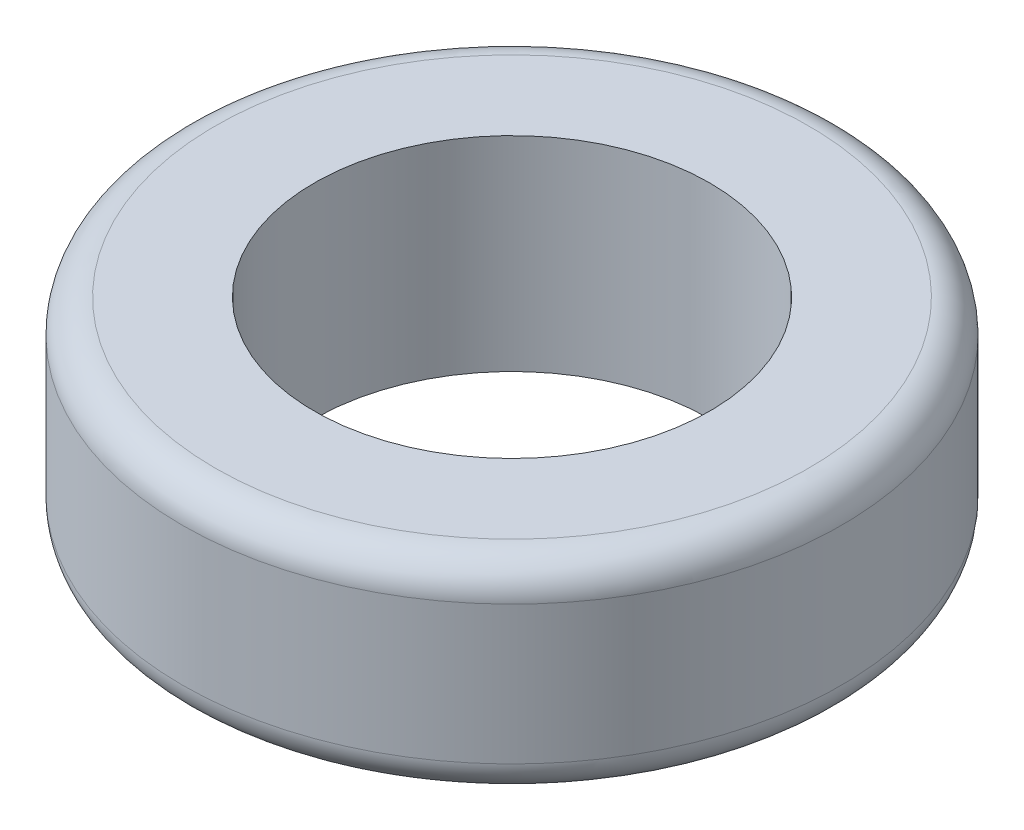
from build123d import *

# Parameters (mm, degrees)
SKETCH1_R           = 10
SKETCH1_R_2         = 6
BOSS_EXTRUDE1_DEPTH = 6.2
FILLET1_R           = 1


with BuildPart() as part:
    # Sketch1 → Boss-Extrude1 (new body)
    with BuildSketch(Plane(origin=(0, 0, 0), x_dir=(1, 0, 0), z_dir=(0, 1, 0))):
        Circle(SKETCH1_R)
        Circle(SKETCH1_R_2, mode=Mode.SUBTRACT)
    extrude(amount=BOSS_EXTRUDE1_DEPTH)

    # Fillet1
    fillet1_edges = [part.edges().sort_by_distance(p)[0] for p in [
        (-10, 0, 0),
        (-10, 6.2, 0),
    ]]
    fillet(fillet1_edges, radius=FILLET1_R)


solid = part.part
